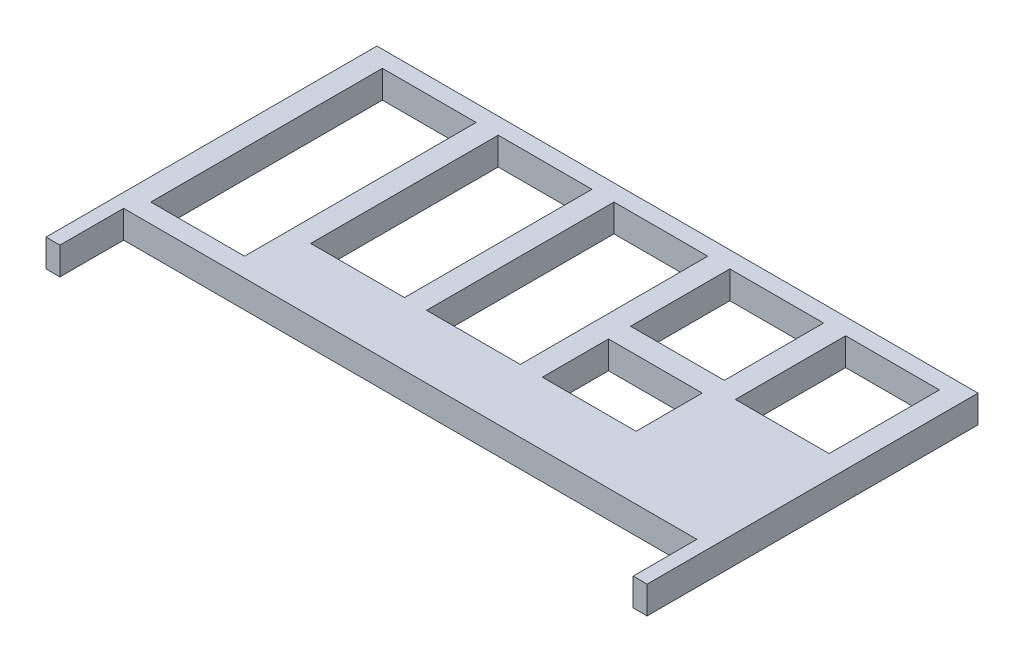
from build123d import *

# Parameters (mm, degrees)
SKETCH1_W           = 17
SKETCH1_H           = 12
SKETCH1_H_2         = 42
SKETCH1_H_3         = 34
SKETCH1_H_4         = 18
SKETCH1_H_5         = 20
BOSS_EXTRUDE1_DEPTH = 5


with BuildPart() as part:
    # Sketch1 → Boss-Extrude1 (new body)
    with BuildSketch(Plane(origin=(0, 0, 0), x_dir=(1, 0, 0), z_dir=(0, 1, 0))):
        Polygon((-54.5, 30), (-54.5, -30), (-51.975, -30), (-51.975, -18.45), (51.975, -18.45), (51.975, -30), (54.5, -30), (54.5, 30), align=None)
        with Locations((21, -1)):
            Rectangle(SKETCH1_W, SKETCH1_H, mode=Mode.SUBTRACT)
        with Locations((-42, 6)):
            Rectangle(SKETCH1_W, SKETCH1_H_2, mode=Mode.SUBTRACT)
        with Locations((-21, 10)):
            Rectangle(SKETCH1_W, SKETCH1_H_3, mode=Mode.SUBTRACT)
        with Locations((0, 10)):
            Rectangle(SKETCH1_W, SKETCH1_H_3, mode=Mode.SUBTRACT)
        with Locations((21, 18)):
            Rectangle(SKETCH1_W, SKETCH1_H_4, mode=Mode.SUBTRACT)
        with Locations((42, 17)):
            Rectangle(SKETCH1_W, SKETCH1_H_5, mode=Mode.SUBTRACT)
    extrude(amount=BOSS_EXTRUDE1_DEPTH)


solid = part.part
